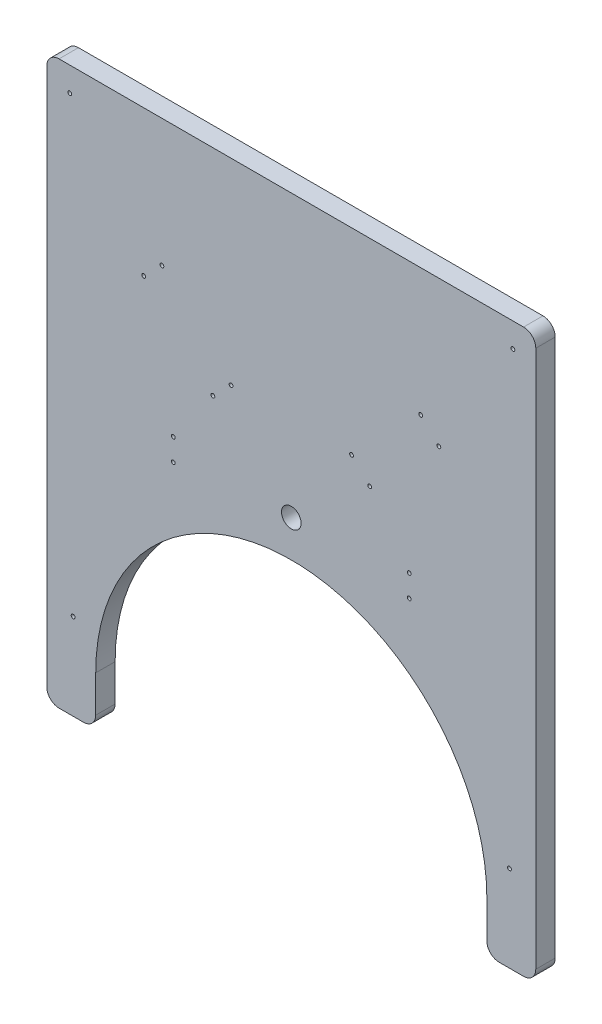
from build123d import *

# Parameters (mm, degrees)
SKETCH1_W           = 400
SKETCH1_H           = 460
BOSS_EXTRUDE1_DEPTH = 15.875
CUT_EXTRUDE1_DEPTH  = 306.208151308
FILLET1_R           = 10
SKETCH3_R           = 8
CUT_EXTRUDE2_DEPTH  = 306.208151308
SKETCH5_R           = 1.5875
CUT_EXTRUDE3_DEPTH  = 306.208151308
SKETCH6_R           = 1.5625
CUT_EXTRUDE4_DEPTH  = 306.208151308
SKETCH7_R           = 1.5625
CUT_EXTRUDE5_DEPTH  = 306.208151308


with BuildPart() as part:
    # Sketch1 → Boss-Extrude1 (new body)
    with BuildSketch(Plane.XY):
        Rectangle(SKETCH1_W, SKETCH1_H)
    extrude(amount=-BOSS_EXTRUDE1_DEPTH)

    # Sketch2 → Cut-Extrude1 (cut, through all)
    with BuildSketch(Plane.XY):
        with BuildLine():
            Line((160, -230), (160, -190))
            ThreePointArc((160, -190), (0, -30), (-160, -190))
            Line((-160, -190), (-160, -230))
            Line((-160, -230), (160, -230))
        make_face()
    extrude(amount=-CUT_EXTRUDE1_DEPTH, mode=Mode.SUBTRACT)

    # Fillet1
    fillet1_edges = [part.edges().sort_by_distance(p)[0] for p in [
        (-160, -230, -7.9375),
        (-200, -230, -7.9375),
        (160, -230, -7.9375),
        (200, -230, -7.9375),
        (-200, 230, -7.9375),
        (200, 230, -7.9375),
    ]]
    fillet(fillet1_edges, radius=FILLET1_R)

    # Sketch3 → Cut-Extrude2 (cut, through all)
    with BuildSketch(Plane.XY):
        Circle(SKETCH3_R)
    extrude(amount=-CUT_EXTRUDE2_DEPTH, mode=Mode.SUBTRACT)

    # Sketch5 → Cut-Extrude3 (cut, through all)
    with BuildSketch(Plane.XY):
        with Locations((-181.2487, 210.112)):
            Circle(SKETCH5_R)
        with Locations((-178.461, -159.2706)):
            Circle(SKETCH5_R)
    cut_extrude3 = extrude(amount=-CUT_EXTRUDE3_DEPTH, mode=Mode.SUBTRACT)

    # Mirror1: Cut-Extrude3 across plane
    add(cut_extrude3.mirror(Plane(origin=(0, 0, 0), x_dir=(0, 0, 1), z_dir=(1, 0, 0))), mode=Mode.SUBTRACT)

    # Sketch6 → Cut-Extrude4 (cut, through all)
    with BuildSketch(Plane.XY):
        with Locations((-96.5, 9)):
            Circle(SKETCH6_R)
        with Locations((-96.5, -9)):
            Circle(SKETCH6_R)
        with Locations((96.5, 9)):
            Circle(SKETCH6_R)
        with Locations((96.5, -9)):
            Circle(SKETCH6_R)
    extrude(amount=-CUT_EXTRUDE4_DEPTH, mode=Mode.SUBTRACT)

    # Sketch7 → Cut-Extrude5 (cut, through all)
    with BuildSketch(Plane.XY):
        with Locations((-49.29110755, 69.140349955)):
            Circle(SKETCH7_R)
        with Locations((-64.140349955, 54.29110755)):
            Circle(SKETCH7_R)
        with Locations((-105.859650045, 125.70889245)):
            Circle(SKETCH7_R)
        with Locations((-120.70889245, 110.859650045)):
            Circle(SKETCH7_R)
        with Locations((105.859650045, 125.70889245)):
            Circle(SKETCH7_R)
        with Locations((120.70889245, 110.859650045)):
            Circle(SKETCH7_R)
        with Locations((49.29110755, 69.140349955)):
            Circle(SKETCH7_R)
        with Locations((64.140349955, 54.29110755)):
            Circle(SKETCH7_R)
    extrude(amount=-CUT_EXTRUDE5_DEPTH, mode=Mode.SUBTRACT)


solid = part.part
